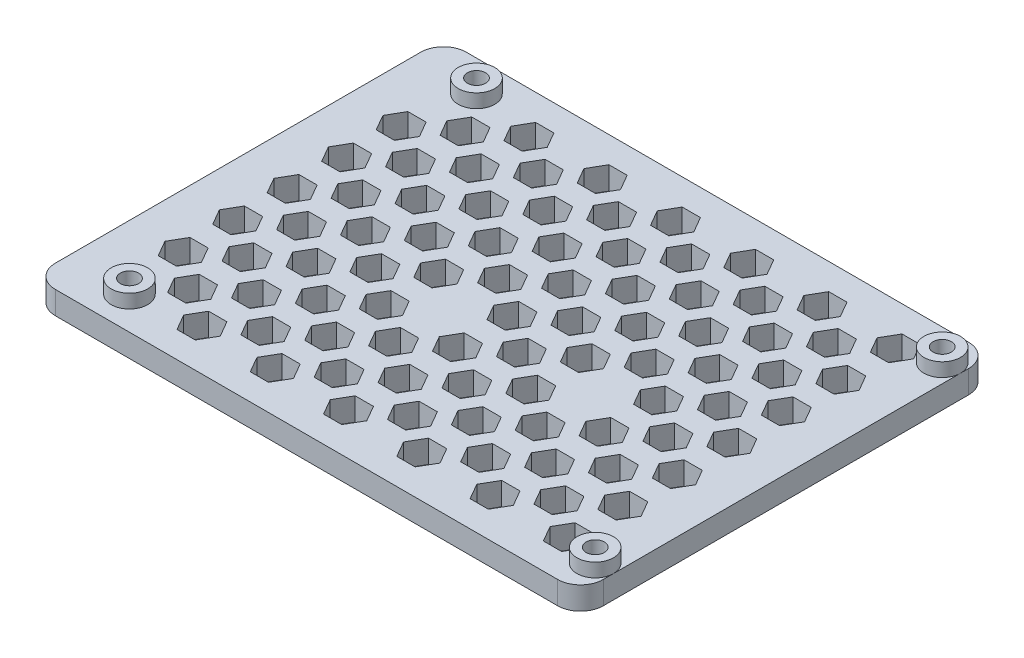
from build123d import *

# Parameters (mm, degrees)
SKETCH2_W            = 120
SKETCH2_H            = 90
BOSS_EXTRUDE1_DEPTH  = 5
SKETCH3_R            = 2.25
CUT_EXTRUDE1_DEPTH   = 3
SKETCH4_R            = 4
BOSS_EXTRUDE2_DEPTH  = 3
SKETCH5_R            = 2
CUT_EXTRUDE2_DEPTH   = 6
FILLET1_R            = 5
CUT_EXTRUDE4_DEPTH   = 5
LPATTERN2_COUNT      = 7
LPATTERN2_PITCH      = 10
LPATTERN2_COUNT_DIR2 = 7
LPATTERN2_PITCH_DIR2 = 10
LPATTERN3_COUNT      = 7
LPATTERN3_PITCH      = 10
LPATTERN3_COUNT_DIR2 = 7
LPATTERN3_PITCH_DIR2 = 10
LPATTERN4_COUNT      = 7
LPATTERN4_PITCH      = 10
LPATTERN4_COUNT_DIR2 = 7
LPATTERN4_PITCH_DIR2 = 10
LPATTERN5_COUNT      = 7
LPATTERN5_PITCH      = 10
LPATTERN5_COUNT_DIR2 = 7
LPATTERN5_PITCH_DIR2 = 10


with BuildPart() as part:
    # Sketch2 → Boss-Extrude1 (new body)
    with BuildSketch(Plane(origin=(0, 0, 0), x_dir=(1, 0, 0), z_dir=(0, 1, 0))):
        Rectangle(SKETCH2_W, SKETCH2_H)
    extrude(amount=BOSS_EXTRUDE1_DEPTH)

    # Sketch3 → Cut-Extrude1 (cut)
    with BuildSketch(Plane.XZ):
        with Locations(Location((-55, 40, 0), (0, 0, 270))):
            Circle(SKETCH3_R)
        with Locations(Location((7, 40, 0), (0, 0, 270))):
            Circle(SKETCH3_R)
        with Locations(Location((24, 6, 0), (0, 0, 270))):
            Circle(SKETCH3_R)
        with Locations(Location((-7, 4, 0), (0, 0, 270))):
            Circle(SKETCH3_R)
    extrude(amount=-CUT_EXTRUDE1_DEPTH, mode=Mode.SUBTRACT)

    # Sketch4 → Boss-Extrude2 (add)
    with BuildSketch(Plane(origin=(0, 5, 0), x_dir=(1, 0, 0), z_dir=(0, 1, 0))):
        with Locations(Location((-46, 38.220365089, 0), (0, 0, 90))):
            Circle(SKETCH4_R)
        with Locations((56, 38.220365089)):
            Circle(SKETCH4_R)
        with Locations((56, -37.779634911)):
            Circle(SKETCH4_R)
        with Locations(Location((-46, -37.779634911, 0), (0, 0, 90))):
            Circle(SKETCH4_R)
    extrude(amount=BOSS_EXTRUDE2_DEPTH)

    # Sketch5 → Cut-Extrude2 (cut)
    with BuildSketch(Plane(origin=(0, 8, 0), x_dir=(1, 0, 0), z_dir=(0, 1, 0))):
        with Locations(Location((-46, 38.220365089, 0), (0, 0, 270))):
            Circle(SKETCH5_R)
        with Locations(Location((56, 38.220365089, 0), (0, 0, 270))):
            Circle(SKETCH5_R)
        with Locations(Location((56, -37.779634911, 0), (0, 0, 270))):
            Circle(SKETCH5_R)
        with Locations(Location((-46, -37.779634911, 0), (0, 0, 270))):
            Circle(SKETCH5_R)
    extrude(amount=-CUT_EXTRUDE2_DEPTH, mode=Mode.SUBTRACT)

    # Fillet1
    fillet1_edges = [part.edges().sort_by_distance(p)[0] for p in [
        (60, 2.5, 45),
        (-60, 2.5, 45),
        (-60, 2.5, -45),
        (60, 2.5, -45),
    ]]
    fillet(fillet1_edges, radius=FILLET1_R)

    # Sketch6 → Cut-Extrude4 (cut)
    with BuildSketch(Plane.XZ):
        Polygon((2, 3.464101615), (-2, 3.464101615), (-4, 0), (-2, -3.464101615), (2, -3.464101615), (4, 0), align=None)
    cut_extrude4 = extrude(amount=-CUT_EXTRUDE4_DEPTH, mode=Mode.SUBTRACT)

    # LPattern2: Cut-Extrude4 7 × 7, 23 skipped
    with Locations(*[Vector(0.8024025324300874, 0, 0.5967831900697124) * (i * LPATTERN2_PITCH) + Vector(-0.8024025324300874, 0, 0.5967831900697126) * (j * LPATTERN2_PITCH_DIR2) for i in range(LPATTERN2_COUNT) for j in range(LPATTERN2_COUNT_DIR2) if (i, j) not in ((0, 0), (0, 1), (0, 6), (1, 6), (2, 5), (2, 6), (3, 4), (3, 5), (3, 6), (4, 3), (4, 4), (4, 5), (4, 6), (5, 2), (5, 3), (5, 4), (5, 5), (5, 6), (6, 1), (6, 2), (6, 3), (6, 4), (6, 5), (6, 6))]):
        add(cut_extrude4, mode=Mode.SUBTRACT)

    # LPattern3: Cut-Extrude4 7 × 7, 24 skipped
    with Locations(*[Vector(-0.8024025324300874, 0, -0.5967831900697124) * (i * LPATTERN3_PITCH) + Vector(-0.8024025324300874, 0, 0.5967831900697126) * (j * LPATTERN3_PITCH_DIR2) for i in range(LPATTERN3_COUNT) for j in range(LPATTERN3_COUNT_DIR2) if (i, j) not in ((0, 0), (0, 1), (0, 6), (1, 6), (2, 5), (2, 6), (3, 4), (3, 5), (3, 6), (4, 3), (4, 4), (4, 5), (4, 6), (5, 2), (5, 3), (5, 4), (5, 5), (5, 6), (6, 0), (6, 1), (6, 2), (6, 3), (6, 4), (6, 5), (6, 6))]):
        add(cut_extrude4, mode=Mode.SUBTRACT)

    # LPattern4: Cut-Extrude4 7 × 7, 22 skipped
    with Locations(*[Vector(0.8024025324300874, 0, -0.5967831900697126) * (i * LPATTERN4_PITCH) + Vector(-0.8024025324300874, 0, -0.5967831900697126) * (j * LPATTERN4_PITCH_DIR2) for i in range(LPATTERN4_COUNT) for j in range(LPATTERN4_COUNT_DIR2) if (i, j) not in ((0, 0), (0, 6), (1, 6), (2, 5), (2, 6), (3, 4), (3, 5), (3, 6), (4, 3), (4, 4), (4, 5), (4, 6), (5, 2), (5, 3), (5, 4), (5, 5), (5, 6), (6, 1), (6, 2), (6, 3), (6, 4), (6, 5), (6, 6))]):
        add(cut_extrude4, mode=Mode.SUBTRACT)

    # LPattern5: Cut-Extrude4 7 × 7, 22 skipped
    with Locations(*[Vector(0.8024025324300873, 0, -0.5967831900697126) * (i * LPATTERN5_PITCH) + Vector(0.8024025324300875, 0, 0.5967831900697125) * (j * LPATTERN5_PITCH_DIR2) for i in range(LPATTERN5_COUNT) for j in range(LPATTERN5_COUNT_DIR2) if (i, j) not in ((0, 0), (1, 2), (1, 6), (2, 5), (2, 6), (3, 4), (3, 5), (3, 6), (4, 3), (4, 4), (4, 5), (4, 6), (5, 2), (5, 3), (5, 4), (5, 5), (5, 6), (6, 1), (6, 2), (6, 3), (6, 4), (6, 5), (6, 6))]):
        add(cut_extrude4, mode=Mode.SUBTRACT)


solid = part.part
